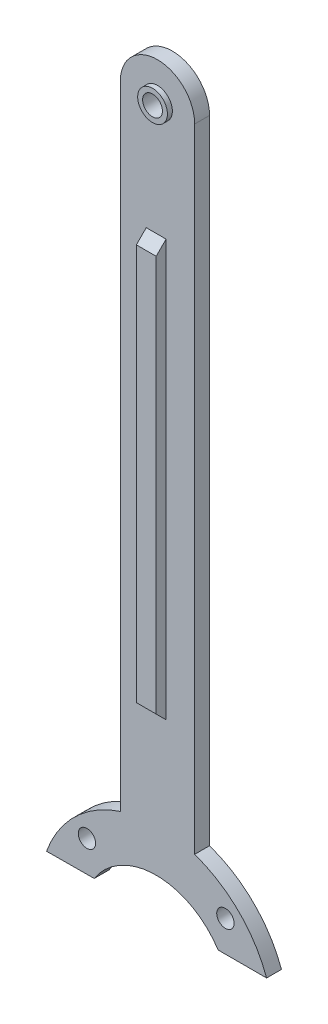
from build123d import *

# Parameters (mm, degrees)
SKETCH1_R           = 1.750000705
SKETCH1_R_2         = 2.000000004
BOSS_EXTRUDE1_DEPTH = 3
SKETCH4_R           = 3
SKETCH4_R_2         = 2
BOSS_EXTRUDE4_DEPTH = 1
SKETCH5_W           = 4
SKETCH5_H           = 100
EXTRUDE_THIN1_DEPTH = 2
CHAMFER1_SIZE       = 10


with BuildPart() as part:
    # Sketch1 → Boss-Extrude1 (new body)
    with BuildSketch(Plane.XY):
        with BuildLine():
            Line((-51.124108856, 36.963592514), (-41.497200727, 37.021376193))
            ThreePointArc((-41.497200727, 37.021376193), (-29.000000097, 43.850000709), (-16.502799466, 37.021376193))
            Line((-16.502799466, 37.021376193), (-6.715362892, 37.021376193))
            ThreePointArc((-6.715362892, 37.021376193), (-12.347919102, 45.842082936), (-21.231959071, 51.374206468))
            Line((-21.231959071, 51.374206468), (-21.231959071, 178.999762083))
            ThreePointArc((-21.231959071, 178.999762083), (-28.731959071, 186.499762083), (-36.231959071, 178.999762083))
            Line((-36.231959071, 178.999762083), (-36.231959071, 51.373953802))
            ThreePointArc((-36.231959071, 51.373953802), (-45.351125633, 45.897802101), (-51.124108856, 36.963592514))
        make_face()
        with Locations((-42.968060821, 43.288996652)):
            Circle(SKETCH1_R, mode=Mode.SUBTRACT)
        with Locations((-15.030000194, 43.288996652)):
            Circle(SKETCH1_R, mode=Mode.SUBTRACT)
        with Locations((-28.731959071, 178.999762083)):
            Circle(SKETCH1_R_2, mode=Mode.SUBTRACT)
    extrude(amount=BOSS_EXTRUDE1_DEPTH)

    # Sketch4 → Boss-Extrude4 (add)
    with BuildSketch(Plane.XY.offset(3)):
        with Locations(Location((-28.731959071, 178.999762083, 0), (0, 0, 180))):
            Circle(SKETCH4_R)
        with Locations((-28.731959071, 178.999762083)):
            Circle(SKETCH4_R_2, mode=Mode.SUBTRACT)
    extrude(amount=BOSS_EXTRUDE4_DEPTH)

    # Sketch5 → Extrude-Thin1 (add)
    with BuildSketch(Plane.XY.offset(3)):
        with Locations((-29.000000097, 114.00215714)):
            Rectangle(SKETCH5_W, SKETCH5_H)
    extrude(amount=EXTRUDE_THIN1_DEPTH)

    # Chamfer1
    # the kernel refuses this chamfer: 10 mm, written as the material it takes off along each edge
    with BuildSketch(Plane(origin=(-1.283170217, 164.00215714, 5), x_dir=(0, 0.0274958766105877, -0.9996219169112968), z_dir=(-1, 0, 0))) as chamfer1_piece_1_section:
        Polygon((CHAMFER1_SIZE * 0.999621916911, CHAMFER1_SIZE * 0.0274958766106), (-CHAMFER1_SIZE * 0.0274958766106, CHAMFER1_SIZE * 0.999621916911), (0, 0), align=None)
    chamfer1_piece_1 = extrude(amount=55.433659759, mode=Mode.PRIVATE)
    chamfer1_piece_1 = split(chamfer1_piece_1, bisect_by=Plane(origin=(-29.000000097, 159.483638622, 3), z_dir=(0, 0, 1)), keep=Keep.TOP, mode=Mode.PRIVATE)
    add(chamfer1_piece_1, mode=Mode.SUBTRACT)
    with BuildSketch(Plane(origin=(-56.716829977, 64.00215714, 5), x_dir=(0, -0.027495876610586317, -0.9996219169112968), z_dir=(1, 0, 0))) as chamfer1_piece_2_section:
        Polygon((CHAMFER1_SIZE * 0.999621916911, CHAMFER1_SIZE * 0.0274958766106), (-CHAMFER1_SIZE * 0.0274958766106, CHAMFER1_SIZE * 0.999621916911), (0, 0), align=None)
    chamfer1_piece_2 = extrude(amount=55.433659759, mode=Mode.PRIVATE)
    chamfer1_piece_2 = split(chamfer1_piece_2, bisect_by=Plane(origin=(-29.000000097, 68.520675659, 3), z_dir=(0, 0, 1)), keep=Keep.TOP, mode=Mode.PRIVATE)
    add(chamfer1_piece_2, mode=Mode.SUBTRACT)


solid = part.part
